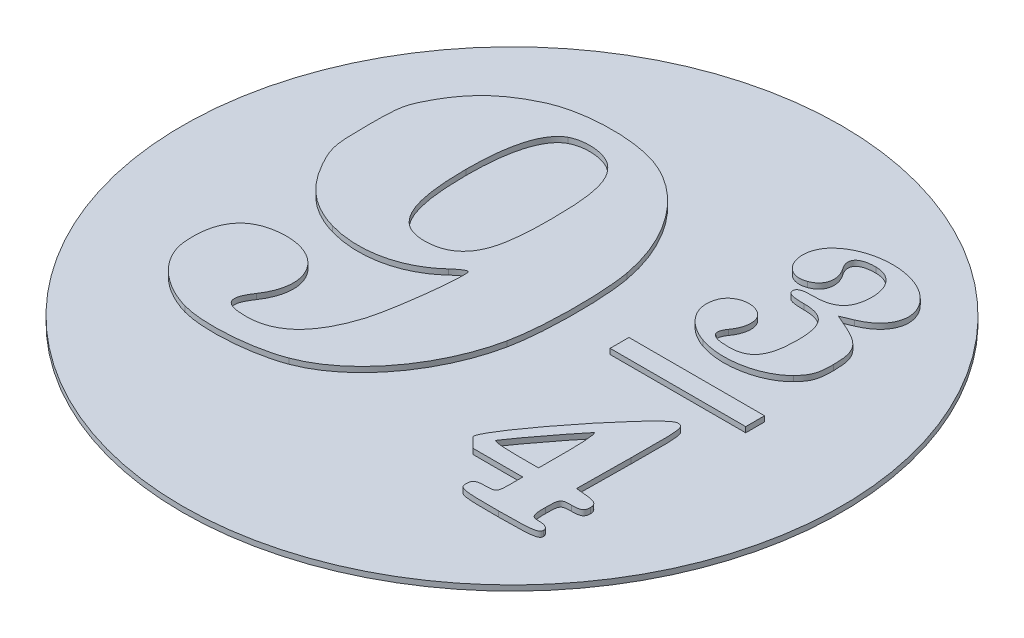
from build123d import *

# Parameters (mm, degrees)
SKETCH_1_R          = 24.5
EXTRUDE_3_DEPTH     = 0.4
EXTRUDE_9_4_3_DEPTH = 0.4


with BuildPart() as part:
    # 草图1 → 凸台-拉伸3 (new body)
    with BuildSketch(Plane(origin=(0, 0, 0), x_dir=(1, 0, 0), z_dir=(0, 1, 0))):
        Circle(SKETCH_1_R)
    extrude(amount=EXTRUDE_3_DEPTH)

    # 草图10 → 凸台-拉伸-9-4-3 (add)
    # profile 1 of 4: a face of its own
    with BuildSketch(Plane(origin=(0, 0.4, 0), x_dir=(1, 0, 0), z_dir=(0, 1, 0))):
        with BuildLine():
            Line((11.175084771, -11.353611454), (11.175084771, -10.373611454))
            Line((11.175084771, -10.373611454), (7.481550162, -10.373611454))
            Line((7.481550162, -10.373611454), (6.707631571, -9.603611454))
            add(Edge.make_bspline(
                [(6.707631571, -9.603611454), (6.724683571, -8.557262654), (12.625453971, -1.133611454), (13.440108371, -1.133611454)],
                knots=[0, 0, 0, 0, 1, 1, 1, 1], degree=3))
            add(Edge.make_bspline(
                [(13.440108371, -1.133611454), (13.977638371, -1.133611454), (13.999525971, -1.302515854), (13.957184371, -5.123611454)],
                knots=[0, 0, 0, 0, 1, 1, 1, 1], degree=3))
            Line((13.957184371, -5.123611454), (13.912969571, -9.113611454))
            Line((13.912969571, -9.113611454), (14.784027171, -9.201352254))
            add(Edge.make_bspline(
                [(14.784027171, -9.201352254), (15.428715971, -9.266289854), (15.655084771, -9.430014254), (15.655084771, -9.831352254)],
                knots=[0, 0, 0, 0, 1, 1, 1, 1], degree=3))
            add(Edge.make_bspline(
                [(15.655084771, -9.831352254), (15.655084771, -10.247197054), (15.459258371, -10.373611454), (14.815084771, -10.373611454)],
                knots=[0, 0, 0, 0, 1, 1, 1, 1], degree=3))
            add(Edge.make_bspline(
                [(14.815084771, -10.373611454), (14.021752371, -10.373611454), (13.975084771, -10.435833054), (13.975084771, -11.493611454)],
                knots=[0, 0, 0, 0, 1, 1, 1, 1], degree=3))
            add(Edge.make_bspline(
                [(13.975084771, -11.493611454), (13.975084771, -12.501611454), (14.045084771, -12.613611454), (14.675084771, -12.613611454)],
                knots=[0, 0, 0, 0, 1, 1, 1, 1], degree=3))
            add(Edge.make_bspline(
                [(14.675084771, -12.613611454), (15.110641571, -12.613611454), (15.375084771, -12.772279054), (15.375084771, -13.033611454)],
                knots=[0, 0, 0, 0, 1, 1, 1, 1], degree=3))
            add(Edge.make_bspline(
                [(15.375084771, -13.033611454), (15.375084771, -13.380279454), (14.861752371, -13.453611454), (12.435084771, -13.453611454)],
                knots=[0, 0, 0, 0, 1, 1, 1, 1], degree=3))
            add(Edge.make_bspline(
                [(12.435084771, -13.453611454), (9.681752371, -13.453611454), (9.495084771, -13.418057054), (9.495084771, -12.893611454)],
                knots=[0, 0, 0, 0, 1, 1, 1, 1], degree=3))
            add(Edge.make_bspline(
                [(9.495084771, -12.893611454), (9.495084771, -12.458054654), (9.681752371, -12.333611454), (10.335084771, -12.333611454)],
                knots=[0, 0, 0, 0, 1, 1, 1, 1], degree=3))
            add(Edge.make_bspline(
                [(10.335084771, -12.333611454), (11.108416771, -12.333611454), (11.175084771, -12.255833054), (11.175084771, -11.353611454)],
                knots=[0, 0, 0, 0, 1, 1, 1, 1], degree=3))
        make_face()
        with BuildLine():
            Line((9.495084771, -9.200945625), (11.175084771, -9.200945625))
            Line((11.175084771, -9.200945625), (11.175084771, -6.904945625))
            add(Edge.make_bspline(
                [(11.175084771, -6.904945625), (11.175084771, -5.642145625), (11.071686371, -4.728645625), (10.945311171, -4.874945625)],
                knots=[0, 0, 0, 0, 1, 1, 1, 1], degree=3))
            add(Edge.make_bspline(
                [(10.945311171, -4.874945625), (10.120386371, -5.829933225), (7.815084771, -8.890459225), (7.815084771, -9.030646825)],
                knots=[0, 0, 0, 0, 1, 1, 1, 1], degree=3))
            add(Edge.make_bspline(
                [(7.815084771, -9.030646825), (7.815084771, -9.124312425), (8.571084771, -9.200945625), (9.495084771, -9.200945625)],
                knots=[0, 0, 0, 0, 1, 1, 1, 1], degree=3))
        make_face(mode=Mode.SUBTRACT)
    # profile 2 of 4: a face of its own
    with BuildSketch(Plane(origin=(0, 0.4, 0), x_dir=(1, 0, 0), z_dir=(0, 1, 0))):
        Polygon((6.135084771, 1.859054375), (6.135084771, 2.559054375), (11.175084771, 2.559054375), (16.215084771, 2.559054375), (16.215084771, 1.859054375), (16.215084771, 1.159054375), (11.175084771, 1.159054375), (6.135084771, 1.159054375), align=None)
    # profile 3 of 4: a face of its own
    with BuildSketch(Plane(origin=(0, 0.4, 0), x_dir=(1, 0, 0), z_dir=(0, 1, 0))):
        with BuildLine():
            Line((13.382193171, 12.065430695), (12.549789571, 11.720637015))
            Line((12.549789571, 11.720637015), (13.612437171, 11.244219535))
            add(Edge.make_bspline(
                [(13.612437171, 11.244219535), (15.107141571, 10.574098615), (15.482778371, 10.006284935), (15.482778371, 8.417008575)],
                knots=[0, 0, 0, 0, 1, 1, 1, 1], degree=3))
            add(Edge.make_bspline(
                [(15.482778371, 8.417008575), (15.482778371, 7.293957695), (15.339729171, 6.892793855), (14.701861171, 6.227002855)],
                knots=[0, 0, 0, 0, 1, 1, 1, 1], degree=3))
            add(Edge.make_bspline(
                [(14.701861171, 6.227002855), (13.503909171, 4.976609935), (10.946918371, 4.481593455), (9.075084771, 5.137696175)],
                knots=[0, 0, 0, 0, 1, 1, 1, 1], degree=3))
            add(Edge.make_bspline(
                [(9.075084771, 5.137696175), (7.376445171, 5.733092375), (6.499487971, 7.048142055), (6.972111171, 8.291234255)],
                knots=[0, 0, 0, 0, 1, 1, 1, 1], degree=3))
            add(Edge.make_bspline(
                [(6.972111171, 8.291234255), (7.281737971, 9.105612295), (8.360009571, 9.456676575), (9.189005571, 9.013011535)],
                knots=[0, 0, 0, 0, 1, 1, 1, 1], degree=3))
            add(Edge.make_bspline(
                [(9.189005571, 9.013011535), (9.892331971, 8.636602775), (9.947253971, 7.689465535), (9.317864371, 6.790884215)],
                knots=[0, 0, 0, 0, 1, 1, 1, 1], degree=3))
            add(Edge.make_bspline(
                [(9.317864371, 6.790884215), (8.768579971, 6.006672815), (9.132011571, 5.647629655), (10.475084771, 5.647629655)],
                knots=[0, 0, 0, 0, 1, 1, 1, 1], degree=3))
            add(Edge.make_bspline(
                [(10.475084771, 5.647629655), (11.963228771, 5.647629655), (12.575084771, 6.519003935), (12.575084771, 8.638344935)],
                knots=[0, 0, 0, 0, 1, 1, 1, 1], degree=3))
            add(Edge.make_bspline(
                [(12.575084771, 8.638344935), (12.575084771, 10.562571295), (12.024713971, 11.239054375), (10.459208771, 11.239054375)],
                knots=[0, 0, 0, 0, 1, 1, 1, 1], degree=3))
            add(Edge.make_bspline(
                [(10.459208771, 11.239054375), (9.539988371, 11.239054375), (9.215084771, 11.348737375), (9.215084771, 11.659054375)],
                knots=[0, 0, 0, 0, 1, 1, 1, 1], degree=3))
            add(Edge.make_bspline(
                [(9.215084771, 11.659054375), (9.215084771, 11.969371375), (9.539988371, 12.079054375), (10.459208771, 12.079054375)],
                knots=[0, 0, 0, 0, 1, 1, 1, 1], degree=3))
            add(Edge.make_bspline(
                [(10.459208771, 12.079054375), (11.895902771, 12.079054375), (12.575084771, 12.753139255), (12.575084771, 14.179054375)],
                knots=[0, 0, 0, 0, 1, 1, 1, 1], degree=3))
            add(Edge.make_bspline(
                [(12.575084771, 14.179054375), (12.575084771, 15.466329175), (11.877845571, 16.279054375), (10.773491971, 16.279054375)],
                knots=[0, 0, 0, 0, 1, 1, 1, 1], degree=3))
            add(Edge.make_bspline(
                [(10.773491971, 16.279054375), (9.535015571, 16.279054375), (9.091907171, 15.739519015), (9.661964771, 14.925646095)],
                knots=[0, 0, 0, 0, 1, 1, 1, 1], degree=3))
            add(Edge.make_bspline(
                [(9.661964771, 14.925646095), (10.280700371, 14.042276615), (10.059998771, 13.121075775), (9.153563171, 12.803619335)],
                knots=[0, 0, 0, 0, 1, 1, 1, 1], degree=3))
            add(Edge.make_bspline(
                [(9.153563171, 12.803619335), (7.498424371, 12.223945975), (6.575519171, 14.504944135), (7.920865971, 15.850289815)],
                knots=[0, 0, 0, 0, 1, 1, 1, 1], degree=3))
            add(Edge.make_bspline(
                [(7.920865971, 15.850289815), (9.451998371, 17.381423335), (12.701053971, 17.469146215), (14.319518371, 16.023050375)],
                knots=[0, 0, 0, 0, 1, 1, 1, 1], degree=3))
            add(Edge.make_bspline(
                [(14.319518371, 16.023050375), (15.802963971, 14.697590575), (15.375067971, 12.890906255), (13.382193171, 12.065430695)],
                knots=[0, 0, 0, 0, 1, 1, 1, 1], degree=3))
        make_face()
    # profile 4 of 4: a face of its own
    with BuildSketch(Plane(origin=(0, 0.4, 0), x_dir=(1, 0, 0), z_dir=(0, 1, 0))):
        with BuildLine():
            add(Edge.make_bspline(
                [(-12.395160109, -11.908850825), (-14.684682589, -11.260034825), (-16.395066509, -9.567661625), (-16.546787869, -7.800945625)],
                knots=[0, 0, 0, 0, 1, 1, 1, 1], degree=3))
            add(Edge.make_bspline(
                [(-16.546787869, -7.800945625), (-16.759731509, -5.321327225), (-15.790793749, -3.916516825), (-13.705470789, -3.681470825)],
                knots=[0, 0, 0, 0, 1, 1, 1, 1], degree=3))
            add(Edge.make_bspline(
                [(-13.705470789, -3.681470825), (-10.507238269, -3.320983425), (-8.805372509, -5.890558825), (-10.545899549, -8.451973625)],
                knots=[0, 0, 0, 0, 1, 1, 1, 1], degree=3))
            add(Edge.make_bspline(
                [(-10.545899549, -8.451973625), (-11.448565229, -9.780366425), (-11.128414349, -10.321427225), (-9.440630629, -10.319898425)],
                knots=[0, 0, 0, 0, 1, 1, 1, 1], degree=3))
            add(Edge.make_bspline(
                [(-9.440630629, -10.319898425), (-7.294269909, -10.317938425), (-5.800735069, -8.889277625), (-4.904704829, -5.980945625)],
                knots=[0, 0, 0, 0, 1, 1, 1, 1], degree=3))
            add(Edge.make_bspline(
                [(-4.904704829, -5.980945625), (-4.435035069, -4.456494025), (-3.821602669, 0.569075055), (-4.074344109, 0.821816495)],
                knots=[0, 0, 0, 0, 1, 1, 1, 1], degree=3))
            add(Edge.make_bspline(
                [(-4.074344109, 0.821816495), (-4.160371029, 0.907843415), (-4.575942269, 0.655299095), (-4.997835909, 0.260606895)],
                knots=[0, 0, 0, 0, 1, 1, 1, 1], degree=3))
            add(Edge.make_bspline(
                [(-4.997835909, 0.260606895), (-6.805234229, -1.430259905), (-9.523380989, -2.014550465), (-12.089151749, -1.263736345)],
                knots=[0, 0, 0, 0, 1, 1, 1, 1], degree=3))
            add(Edge.make_bspline(
                [(-12.089151749, -1.263736345), (-14.012791509, -0.700827145), (-15.361830109, 0.417667575), (-16.410962669, 2.319499535)],
                knots=[0, 0, 0, 0, 1, 1, 1, 1], degree=3))
            add(Edge.make_bspline(
                [(-16.410962669, 2.319499535), (-17.162930949, 3.682642015), (-17.238488109, 4.061030655), (-17.241548509, 6.479054375)],
                knots=[0, 0, 0, 0, 1, 1, 1, 1], degree=3))
            add(Edge.make_bspline(
                [(-17.241548509, 6.479054375), (-17.244617309, 8.903545255), (-17.171872749, 9.270911135), (-16.419922389, 10.628332935)],
                knots=[0, 0, 0, 0, 1, 1, 1, 1], degree=3))
            add(Edge.make_bspline(
                [(-16.419922389, 10.628332935), (-15.409978909, 12.451484895), (-14.119197949, 13.618452095), (-12.077691909, 14.554050255)],
                knots=[0, 0, 0, 0, 1, 1, 1, 1], degree=3))
            add(Edge.make_bspline(
                [(-12.077691909, 14.554050255), (-10.085727949, 15.466943775), (-6.552902989, 15.573853655), (-4.303248309, 14.789319415)],
                knots=[0, 0, 0, 0, 1, 1, 1, 1], degree=3))
            add(Edge.make_bspline(
                [(-4.303248309, 14.789319415), (-1.260796309, 13.728308975), (1.207945771, 10.490202215), (1.911623291, 6.637629855)],
                knots=[0, 0, 0, 0, 1, 1, 1, 1], degree=3))
            add(Edge.make_bspline(
                [(1.911623291, 6.637629855), (2.329347171, 4.350628215), (2.283790331, -0.011021945), (1.819295251, -2.201890065)],
                knots=[0, 0, 0, 0, 1, 1, 1, 1], degree=3))
            add(Edge.make_bspline(
                [(1.819295251, -2.201890065), (0.918676651, -6.449808425), (-1.926067349, -10.192529225), (-5.177652469, -11.407508025)],
                knots=[0, 0, 0, 0, 1, 1, 1, 1], degree=3))
            add(Edge.make_bspline(
                [(-5.177652469, -11.407508025), (-7.247404909, -12.180887625), (-10.610797949, -12.414514025), (-12.395160109, -11.908850825)],
                knots=[0, 0, 0, 0, 1, 1, 1, 1], degree=3))
        make_face()
        with BuildLine():
            add(Edge.make_bspline(
                [(-5.822945229, 1.723432735), (-4.749775789, 2.567587935), (-4.374074869, 4.018566975), (-4.374074869, 7.319054375)],
                knots=[0, 0, 0, 0, 1, 1, 1, 1], degree=3))
            add(Edge.make_bspline(
                [(-4.374074869, 7.319054375), (-4.374074869, 10.619541775), (-4.749775789, 12.070520815), (-5.822945229, 12.914676015)],
                knots=[0, 0, 0, 0, 1, 1, 1, 1], degree=3))
            add(Edge.make_bspline(
                [(-5.822945229, 12.914676015), (-6.608814789, 13.532840975), (-8.130337029, 13.656410575), (-9.029660069, 13.175107655)],
                knots=[0, 0, 0, 0, 1, 1, 1, 1], degree=3))
            add(Edge.make_bspline(
                [(-9.029660069, 13.175107655), (-10.162153949, 12.569015175), (-10.760741589, 10.533092335), (-10.751415349, 7.319054375)],
                knots=[0, 0, 0, 0, 1, 1, 1, 1], degree=3))
            add(Edge.make_bspline(
                [(-10.751415349, 7.319054375), (-10.742113749, 4.113760535), (-10.250830229, 2.329130975), (-9.169199469, 1.571527415)],
                knots=[0, 0, 0, 0, 1, 1, 1, 1], degree=3))
            add(Edge.make_bspline(
                [(-9.169199469, 1.571527415), (-8.324245709, 0.979698695), (-6.673163829, 1.054650775), (-5.822945229, 1.723432735)],
                knots=[0, 0, 0, 0, 1, 1, 1, 1], degree=3))
        make_face(mode=Mode.SUBTRACT)
    extrude(amount=EXTRUDE_9_4_3_DEPTH)


solid = part.part
